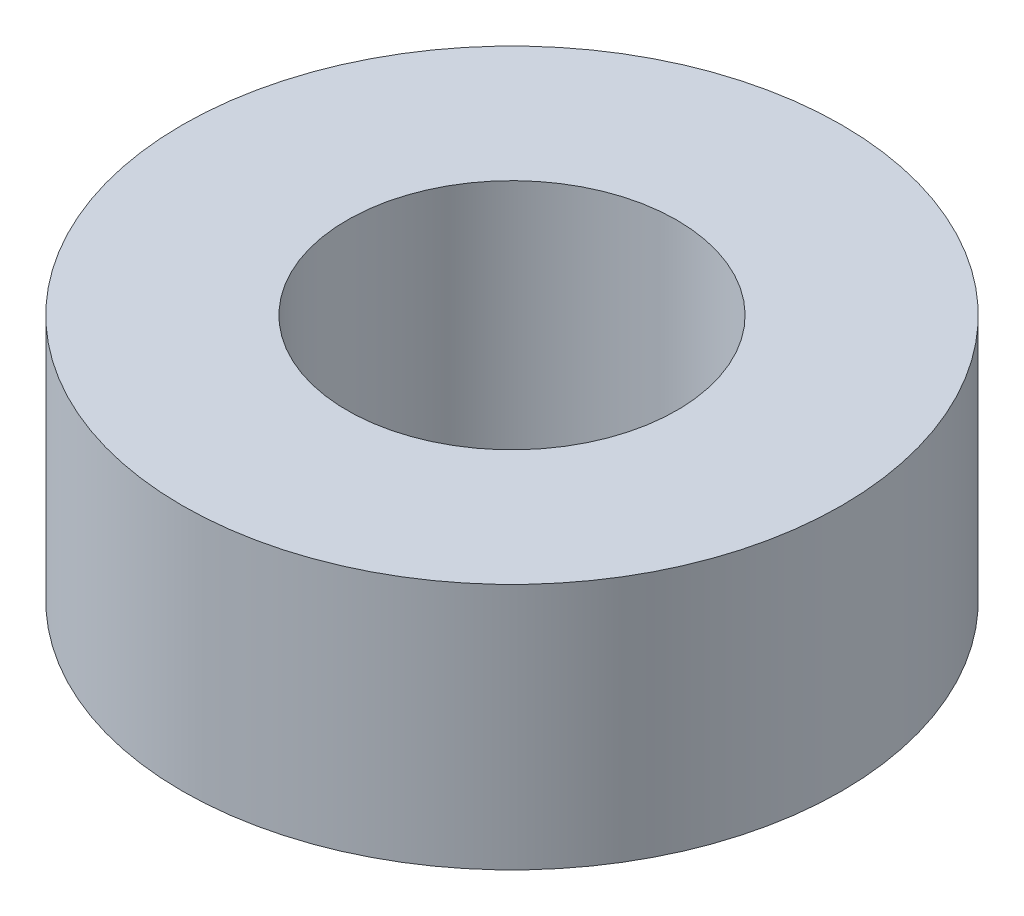
from build123d import *

# Parameters (mm, degrees)
SKETCH1_R           = 6.35
SKETCH1_R_2         = 3.175
BOSS_EXTRUDE2_DEPTH = 4.7625


with BuildPart() as part:
    # Sketch1 → Boss-Extrude2 (new body)
    with BuildSketch(Plane(origin=(0, 0, 0), x_dir=(1, 0, 0), z_dir=(0, 1, 0))):
        Circle(SKETCH1_R)
        Circle(SKETCH1_R_2, mode=Mode.SUBTRACT)
    extrude(amount=BOSS_EXTRUDE2_DEPTH)


solid = part.part
